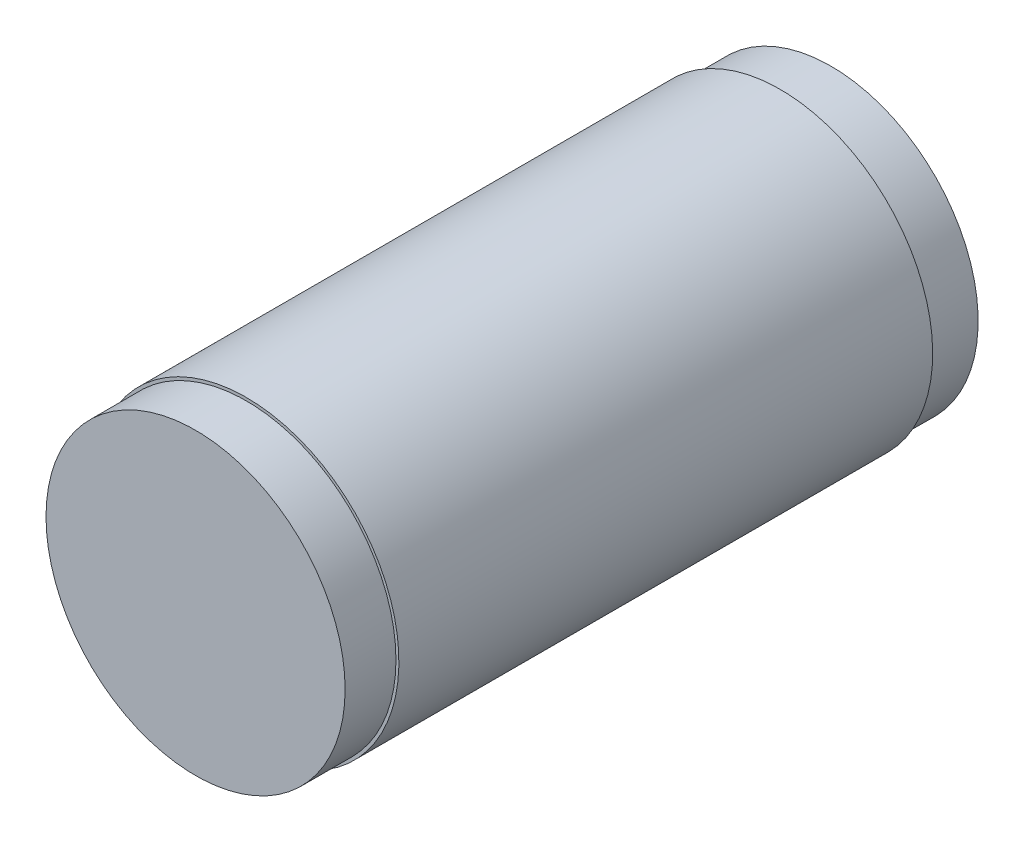
from build123d import *

# Parameters (mm, degrees)
SKETCH1_R                               = 30
SKETCH1_R_2                             = 25
BOSS_EXTRUDE1_DEPTH                     = 125
SKETCH2_R                               = 25
SKETCH2_R_2                             = 21.1
BOSS_EXTRUDE2_DEPTH                     = 10
SKETCH3_R                               = 25
BOSS_EXTRUDE3_DEPTH                     = 10
SKETCH11_R                              = 30
SKETCH11_R_2                            = 28.945980101
CUT_EXTRUDE2_DEPTH                      = 10
CUT_EXTRUDE3_START                      = -10
SKETCH12_R                              = 30
SKETCH12_R_2                            = 29.420954363
CUT_EXTRUDE3_DEPTH                      = 10
CBORE_START                             = -30.0000001
CBORE_FOR_M5_HEX_HEAD_BOLT2_OUTLINE_R   = 6.12
CBORE_FOR_M5_HEX_HEAD_BOLT2_DEPTH       = 3.5800001
CBORE_START_2                           = -26.42
CBORE_FOR_M5_HEX_HEAD_BOLT2_2_OUTLINE_R = 2.65
CBORE_FOR_M5_HEX_HEAD_BOLT2_2_DEPTH     = 1.560846858
CBORE_FOR_M5_HEX_HEAD_BOLT2_3_OUTLINE_R = 6.12
CBORE_FOR_M5_HEX_HEAD_BOLT2_3_DEPTH     = 3.5800001
CBORE_FOR_M5_HEX_HEAD_BOLT2_4_OUTLINE_R = 2.65
CBORE_FOR_M5_HEX_HEAD_BOLT2_4_DEPTH     = 1.560846858


# Read off the part's stored shape, not the designer's step: CBORE for M5 Hex Head Bolt2
with BuildPart() as part:
    # Sketch1 → Boss-Extrude1 (new body)
    with BuildSketch(Plane.XY):
        Circle(SKETCH1_R)
        Circle(SKETCH1_R_2, mode=Mode.SUBTRACT)
    extrude(amount=BOSS_EXTRUDE1_DEPTH)

    # Sketch2 → Boss-Extrude2 (add)
    with BuildSketch(Plane.XY):
        Circle(SKETCH2_R)
        Circle(SKETCH2_R_2, mode=Mode.SUBTRACT)
    extrude(amount=BOSS_EXTRUDE2_DEPTH)

    # Sketch3 → Boss-Extrude3 (add)
    with BuildSketch(Plane.XY.offset(115)):
        Circle(SKETCH3_R)
    extrude(amount=BOSS_EXTRUDE3_DEPTH)

    # Sketch11 → Cut-Extrude2 (cut)
    with BuildSketch(Plane(origin=(0, 0, 0), x_dir=(-1, 0, 0), z_dir=(0, 0, -1))):
        Circle(SKETCH11_R)
        Circle(SKETCH11_R_2, mode=Mode.SUBTRACT)
    extrude(amount=-CUT_EXTRUDE2_DEPTH, mode=Mode.SUBTRACT)

    # Sketch12 → Cut-Extrude3 (cut)
    with BuildSketch(Plane.XY.offset(125).offset(CUT_EXTRUDE3_START)):
        with Locations(Location((0, 0, 0), (0, 0, 180))):
            Circle(SKETCH12_R)
        Circle(SKETCH12_R_2, mode=Mode.SUBTRACT)
    extrude(amount=CUT_EXTRUDE3_DEPTH, mode=Mode.SUBTRACT)

    # CBORE for M5 Hex Head Bolt2 outline → CBORE for M5 Hex Head Bolt2 (cut)
    with BuildSketch(Plane(origin=(0, 0, 0), x_dir=(0.48168847359227474, -0.8763425211687177, 0), z_dir=(0.8763425211687177, 0.48168847359227485, 0)).offset(CBORE_START)):
        with Locations((0, -15.551111343)):
            Circle(CBORE_FOR_M5_HEX_HEAD_BOLT2_OUTLINE_R)
    extrude(amount=CBORE_FOR_M5_HEX_HEAD_BOLT2_DEPTH, mode=Mode.SUBTRACT)

    # CBORE for M5 Hex Head Bolt2 2 outline → CBORE for M5 Hex Head Bolt2 2 (cut)
    with BuildSketch(Plane(origin=(0, 0, 0), x_dir=(0.48168847359227474, -0.8763425211687177, 0), z_dir=(0.8763425211687177, 0.48168847359227485, 0)).offset(CBORE_START_2)):
        with Locations((0, -15.551111343)):
            Circle(CBORE_FOR_M5_HEX_HEAD_BOLT2_2_OUTLINE_R)
    extrude(amount=CBORE_FOR_M5_HEX_HEAD_BOLT2_2_DEPTH, mode=Mode.SUBTRACT)

    # CBORE for M5 Hex Head Bolt2 3 outline → CBORE for M5 Hex Head Bolt2 3 (cut)
    with BuildSketch(Plane(origin=(0, 0, 0), x_dir=(0.49930336052922, -0.8664272353546071, 0), z_dir=(0.8664272353546071, 0.49930336052922003, 0)).offset(CBORE_START)):
        with Locations((0, -109.335103389)):
            Circle(CBORE_FOR_M5_HEX_HEAD_BOLT2_3_OUTLINE_R)
    extrude(amount=CBORE_FOR_M5_HEX_HEAD_BOLT2_3_DEPTH, mode=Mode.SUBTRACT)

    # CBORE for M5 Hex Head Bolt2 4 outline → CBORE for M5 Hex Head Bolt2 4 (cut)
    with BuildSketch(Plane(origin=(0, 0, 0), x_dir=(0.49930336052922, -0.8664272353546071, 0), z_dir=(0.8664272353546071, 0.49930336052922003, 0)).offset(CBORE_START_2)):
        with Locations((0, -109.335103389)):
            Circle(CBORE_FOR_M5_HEX_HEAD_BOLT2_4_OUTLINE_R)
    extrude(amount=CBORE_FOR_M5_HEX_HEAD_BOLT2_4_DEPTH, mode=Mode.SUBTRACT)


solid = part.part
